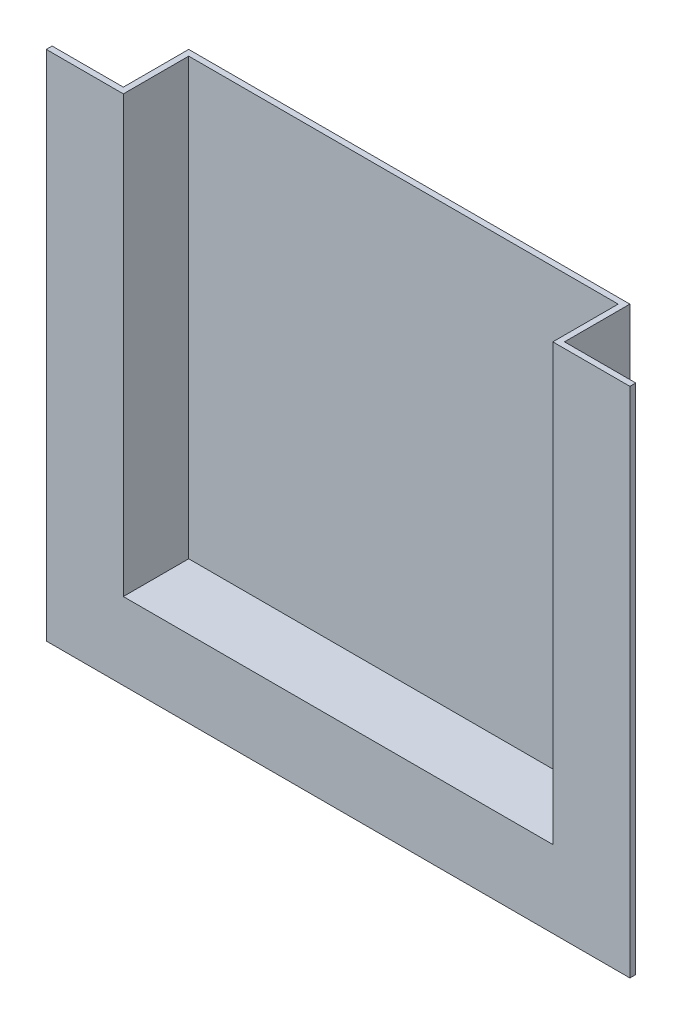
from build123d import *

# Parameters (mm, degrees)
SKETCH1_W           = 96
SKETCH1_H           = 96
BOSS_EXTRUDE1_DEPTH = 15.494
SKETCH2_W           = 127
SKETCH2_H           = 111.5
BOSS_EXTRUDE2_DEPTH = 1.27
SHELL1_START        = -46.73
SHELL1_OUTLINE_W    = 94.73
SHELL1_OUTLINE_H    = 14.224
SHELL1_DEPTH        = 93.46


# Read off the part's stored shape, not the designer's step: Shell1
with BuildPart() as part:
    # Sketch1 → Boss-Extrude1 (new body)
    with BuildSketch(Plane.XY):
        Rectangle(SKETCH1_W, SKETCH1_H)
    extrude(amount=BOSS_EXTRUDE1_DEPTH)

    # Sketch2 → Boss-Extrude2 (add)
    with BuildSketch(Plane.XY.offset(15.494)):
        with Locations((0, -7.75)):
            Rectangle(SKETCH2_W, SKETCH2_H)
    extrude(amount=-BOSS_EXTRUDE2_DEPTH)

    # Shell1 outline → Shell1 (cut)
    with BuildSketch(Plane.YZ.offset(SHELL1_START)):
        with Locations((0.635, 8.382)):
            Rectangle(SHELL1_OUTLINE_W, SHELL1_OUTLINE_H)
    extrude(amount=SHELL1_DEPTH, mode=Mode.SUBTRACT)


solid = part.part
